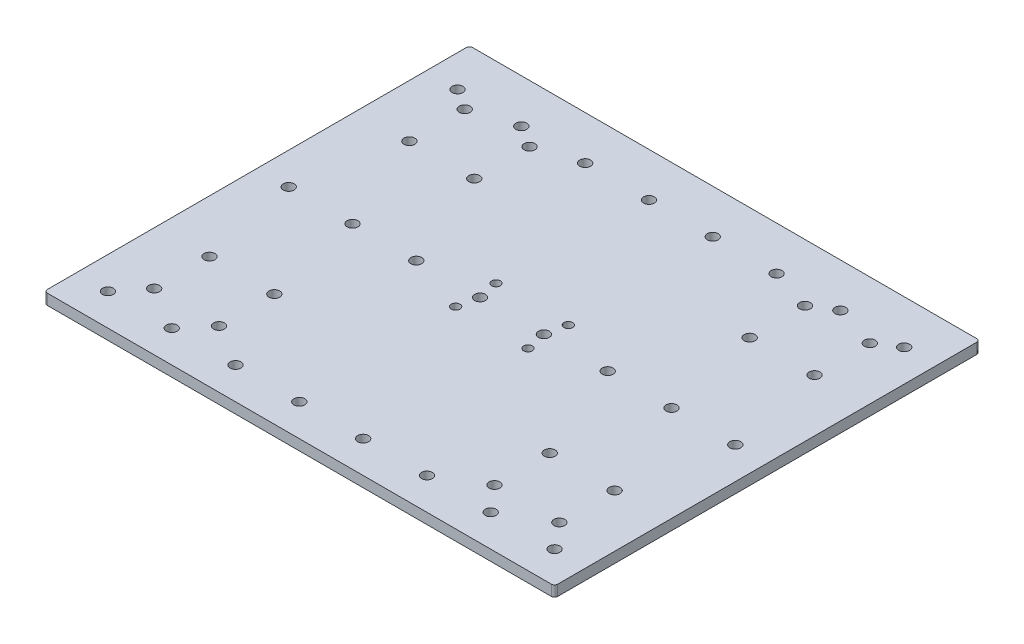
from build123d import *

# Parameters (mm, degrees)
SKETCH1_W           = 240
SKETCH1_H           = 200
BOSS_EXTRUDE1_DEPTH = 2.5
SKETCH2_R           = 2.55
CUT_EXTRUDE1_DEPTH  = 157.284996081
SKETCH3_R           = 2.05
CUT_EXTRUDE2_DEPTH  = 157.284996081
SKETCH4_R           = 2.55
CUT_EXTRUDE3_DEPTH  = 157.284996081
FILLET1_R           = 1.5


with BuildPart() as part:
    # Sketch1 → Boss-Extrude1 (new, symmetric)
    with BuildSketch(Plane(origin=(0, 0, 0), x_dir=(1, 0, 0), z_dir=(0, 1, 0))):
        Rectangle(SKETCH1_W, SKETCH1_H)
    extrude(amount=BOSS_EXTRUDE1_DEPTH, both=True)

    # Sketch2 → Cut-Extrude1 (cut, through all)
    with BuildSketch(Plane(origin=(0, 2.5, 0), x_dir=(1, 0, 0), z_dir=(0, 1, 0))):
        with Locations((-95.25, 73)):
            Circle(SKETCH2_R)
        with Locations((-95.25, 47)):
            Circle(SKETCH2_R)
        with Locations((-64.75, 73)):
            Circle(SKETCH2_R)
        with Locations((-64.75, 47)):
            Circle(SKETCH2_R)
        with Locations((-95.25, -47)):
            Circle(SKETCH2_R)
        with Locations((-95.25, -73)):
            Circle(SKETCH2_R)
        with Locations((-64.75, -73)):
            Circle(SKETCH2_R)
        with Locations((-64.75, -47)):
            Circle(SKETCH2_R)
        with Locations((95.25, -47)):
            Circle(SKETCH2_R)
        with Locations((64.75, -47)):
            Circle(SKETCH2_R)
        with Locations((64.75, -73)):
            Circle(SKETCH2_R)
        with Locations((95.25, -73)):
            Circle(SKETCH2_R)
        with Locations((64.75, 73)):
            Circle(SKETCH2_R)
        with Locations((64.75, 47)):
            Circle(SKETCH2_R)
        with Locations((95.25, 73)):
            Circle(SKETCH2_R)
        with Locations((95.25, 47)):
            Circle(SKETCH2_R)
    extrude(amount=-CUT_EXTRUDE1_DEPTH, mode=Mode.SUBTRACT)

    # Sketch3 → Cut-Extrude2 (cut, through all)
    with BuildSketch(Plane(origin=(0, 2.5, 0), x_dir=(1, 0, 0), z_dir=(0, 1, 0))):
        with Locations((-17, 9.5)):
            Circle(SKETCH3_R)
        with Locations((17, 9.5)):
            Circle(SKETCH3_R)
        with Locations((17, -9.5)):
            Circle(SKETCH3_R)
        with Locations((-17, -9.5)):
            Circle(SKETCH3_R)
    extrude(amount=-CUT_EXTRUDE2_DEPTH, mode=Mode.SUBTRACT)

    # Sketch4 → Cut-Extrude3 (cut, through all)
    with BuildSketch(Plane(origin=(0, 2.5, 0), x_dir=(1, 0, 0), z_dir=(0, 1, 0))):
        with Locations((-105, 79.393522691)):
            Circle(SKETCH4_R)
        with Locations((-75, 79.393522691)):
            Circle(SKETCH4_R)
        with Locations((-45, 79.393522691)):
            Circle(SKETCH4_R)
        with Locations((-15, 79.393522691)):
            Circle(SKETCH4_R)
        with Locations((15, 79.393522691)):
            Circle(SKETCH4_R)
        with Locations((45, 79.393522691)):
            Circle(SKETCH4_R)
        with Locations((75, 79.393522691)):
            Circle(SKETCH4_R)
        with Locations((105, 79.393522691)):
            Circle(SKETCH4_R)
        with Locations((-105, 0)):
            Circle(SKETCH4_R)
        with Locations((-105, -85)):
            Circle(SKETCH4_R)
        with Locations((-75, 0)):
            Circle(SKETCH4_R)
        with Locations((-45, 0)):
            Circle(SKETCH4_R)
        with Locations((-15, 0)):
            Circle(SKETCH4_R)
        with Locations((15, 0)):
            Circle(SKETCH4_R)
        with Locations((45, 0)):
            Circle(SKETCH4_R)
        with Locations((75, 0)):
            Circle(SKETCH4_R)
        with Locations((105, 0)):
            Circle(SKETCH4_R)
        with Locations((-75, -85)):
            Circle(SKETCH4_R)
        with Locations((-45, -85)):
            Circle(SKETCH4_R)
        with Locations((-15, -85)):
            Circle(SKETCH4_R)
        with Locations((15, -85)):
            Circle(SKETCH4_R)
        with Locations((45, -85)):
            Circle(SKETCH4_R)
        with Locations((75, -85)):
            Circle(SKETCH4_R)
        with Locations((105, -85)):
            Circle(SKETCH4_R)
    extrude(amount=-CUT_EXTRUDE3_DEPTH, mode=Mode.SUBTRACT)

    # Fillet1
    fillet1_edges = [part.edges().sort_by_distance(p)[0] for p in [
        (-120, 0, -100),
        (120, 0, -100),
        (-120, 0, 100),
        (120, 0, 100),
    ]]
    fillet(fillet1_edges, radius=FILLET1_R)


solid = part.part
